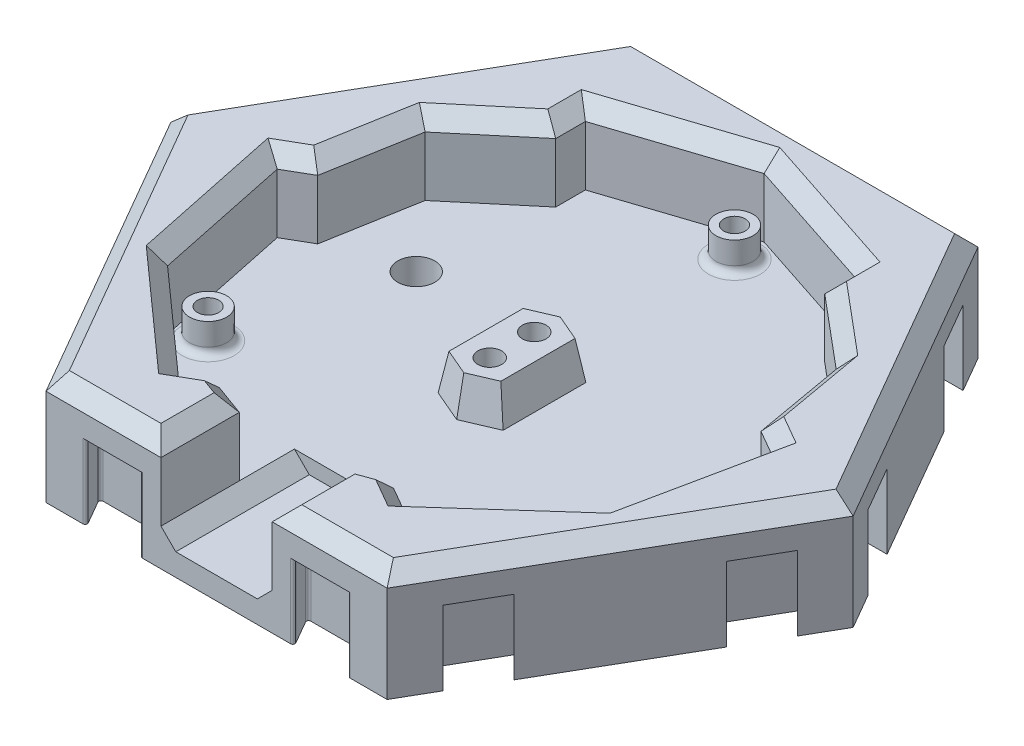
from build123d import *

# Parameters (mm, degrees)
BOSS_EXTRUDE1_DEPTH      = 15
CUT_EXTRUDE1_DEPTH       = 10
CIRPATTERN1_COUNT        = 3
CHAMFER1_SIZE            = 2
BOSS_EXTRUDE2_DEPTH      = 5
DRAFT1_ANGLE             = 10
SKETCH6_R                = 1.6
CUT_EXTRUDE2_DEPTH       = 106.872564907
SKETCH7_R                = 2.5
BOSS_EXTRUDE3_DEPTH      = 4
FILLET3_R                = 1
SKETCH11_R               = 1.44
CUT_EXTRUDE6_DEPTH       = 106.782796333
CIRPATTERN2_COUNT        = 3
FILLET3_OF_CIRPATTERN2_R = 1
SKETCH8_W                = 15
SKETCH8_H                = 12
CUT_EXTRUDE3_DEPTH       = 18
CHAMFER2_SIZE            = 2
CUT_EXTRUDE4_DEPTH       = 10
FILLET2_R                = 0.3
CIRPATTERN3_DEPTH        = 10
CUT_EXTRUDE7_DEPTH       = 7
SKETCH14_R               = 2.5
CUT_EXTRUDE8_DEPTH       = 107.46126056


# Read off the part's stored shape, not the designer's step: CirPattern3
with BuildPart() as part:
    # Sketch1 → Boss-Extrude1 (new body)
    with BuildSketch(Plane(origin=(0, 0, 0), x_dir=(1, 0, 0), z_dir=(0, 1, 0))):
        Polygon((0, 0), (46, 0), (69, 39.837168574), (46, 79.674337148), (0, 79.674337148), (-23, 39.837168574), align=None)
    extrude(amount=BOSS_EXTRUDE1_DEPTH)

    # Sketch4 → Cut-Extrude1 (cut)
    with BuildSketch(Plane(origin=(0, 15, 0), x_dir=(1, 0, 0), z_dir=(0, 1, 0))):
        Polygon((23, 7.837168574), (34.74615776, 12.112420366), (38.210259375, 10.112420366), (52.444863729, 22.837168574), (56.347516757, 41.527071661), (52.883415142, 43.527071661), (50.712812921, 55.837168574), (23, 39.837168574), align=None)
    cut_extrude1 = extrude(amount=-CUT_EXTRUDE1_DEPTH, mode=Mode.SUBTRACT)

    # CirPattern1: Cut-Extrude1 ×3 about axis
    cirpattern1_axis = Axis((23, 0, -39.837168574), (0, 1, 0))
    for i in range(1, CIRPATTERN1_COUNT):
        add(cut_extrude1.rotate(cirpattern1_axis, i * 360 / CIRPATTERN1_COUNT), mode=Mode.SUBTRACT)

    # Chamfer1
    chamfer1_edges = [part.edges().sort_by_distance(p)[0] for p in [
        (57.5, 15, -19.918584287),
        (57.5, 15, -59.755752861),
        (23, 15, -79.674337148),
        (-11.5, 15, -59.755752861),
        (28.87307888, 15, -9.97479447),
        (36.478208567, 15, -11.112420366),
        (45.327561552, 15, -16.47479447),
        (54.396190243, 15, -32.182120118),
        (54.61546595, 15, -42.527071661),
        (51.798114032, 15, -49.682120118),
        (-11.5, 15, -19.918584287),
        (45.925035152, 15, -59.854591135),
        (41.137257382, 15, -65.872013695),
        (32.068628691, 15, -70.854591135),
        (13.931371309, 15, -70.854591135),
        (4.862742618, 15, -65.872013695),
        (0.074964848, 15, -59.854591135),
        (-5.798114032, 15, -49.682120118),
        (-8.61546595, 15, -42.527071661),
        (-8.396190243, 15, -32.182120118),
        (0.672438448, 15, -16.47479447),
        (9.521791433, 15, -11.112420366),
        (17.12692112, 15, -9.97479447),
        (23, 15, 0),
    ]]
    chamfer(chamfer1_edges, length=CHAMFER1_SIZE)

    # Sketch5 → Boss-Extrude2 (add)
    with BuildSketch(Plane(origin=(0, 5, 0), x_dir=(1, 0, 0), z_dir=(0, 1, 0))):
        Polygon((26.5, 44.837168574), (26.5, 34.837168574), (23, 33.337168574), (19.5, 34.837168574), (19.5, 44.837168574), (23, 46.337168574), align=None)
    extrude(amount=BOSS_EXTRUDE2_DEPTH)

    # Draft1
    draft1_faces = [part.faces().sort_by_distance(p)[0] for p in [
        (19.5, 7.5, -39.837168574),
        (21.25, 7.5, -45.587168574),
        (24.75, 7.5, -45.587168574),
        (26.5, 7.5, -39.837168574),
        (21.25, 7.5, -34.087168574),
        (24.75, 7.5, -34.087168574),
    ]]
    draft(draft1_faces, Plane.ZX.offset(10), DRAFT1_ANGLE)

    # Sketch6 → Cut-Extrude2 (cut, through all)
    with BuildSketch(Plane(origin=(0, 10, 0), x_dir=(1, 0, 0), z_dir=(0, 1, 0))):
        with Locations(Location((23, 42.837168574, 0), (0, 0, 270))):
            Circle(SKETCH6_R)
        with Locations(Location((23, 36.837168574, 0), (0, 0, 270))):
            Circle(SKETCH6_R)
    extrude(amount=-CUT_EXTRUDE2_DEPTH, mode=Mode.SUBTRACT)

    # Sketch7 → Boss-Extrude3 (add)
    with BuildSketch(Plane(origin=(0, 5, 0), x_dir=(1, 0, 0), z_dir=(0, 1, 0))):
        with Locations(Location((48.980762114, 24.837168574, 0), (0, 0, 90))):
            Circle(SKETCH7_R)
    boss_extrude3 = extrude(amount=BOSS_EXTRUDE3_DEPTH)

    # Fillet3
    fillet3_edges = [part.edges().sort_by_distance(p)[0] for p in [
        (48.980762114, 5, -22.337168574),
    ]]
    fillet(fillet3_edges, radius=FILLET3_R)

    # Sketch11 → Cut-Extrude6 (cut, through all)
    with BuildSketch(Plane(origin=(0, 9, 0), x_dir=(1, 0, 0), z_dir=(0, 1, 0))):
        with Locations(Location((48.980762114, 24.837168574, 0), (0, 0, 270))):
            Circle(SKETCH11_R)
    cut_extrude6 = extrude(amount=-CUT_EXTRUDE6_DEPTH, mode=Mode.SUBTRACT)

    # CirPattern2: Boss-Extrude3, Cut-Extrude6 ×3 about axis
    cirpattern2_axis = Axis((23, 0, -39.837168574), (0, 1, 0))
    add([boss_extrude3.rotate(cirpattern2_axis, i * 360 / CIRPATTERN2_COUNT) for i in range(1, CIRPATTERN2_COUNT)])
    add([cut_extrude6.rotate(cirpattern2_axis, i * 360 / CIRPATTERN2_COUNT) for i in range(1, CIRPATTERN2_COUNT)], mode=Mode.SUBTRACT)

    # Fillet3 of CirPattern2
    fillet3_of_cirpattern2_edges = [part.edges().sort_by_distance(p)[0] for p in [
        (25.165063509, 5, -71.087168574),
        (-5.145825623, 5, -26.087168574),
    ]]
    fillet(fillet3_of_cirpattern2_edges, radius=FILLET3_OF_CIRPATTERN2_R)

    # Sketch8 → Cut-Extrude3 (cut)
    with BuildSketch(Plane.XY):
        with Locations((23, 9)):
            Rectangle(SKETCH8_W, SKETCH8_H)
    extrude(amount=-CUT_EXTRUDE3_DEPTH, mode=Mode.SUBTRACT)

    # Chamfer2
    chamfer2_edges = [part.edges().sort_by_distance(p)[0] for p in [
        (30.5, 15, -5.219294893),
        (30.5, 3, -9),
        (15.5, 3, -9),
        (15.5, 15, -5.219294893),
    ]]
    chamfer(chamfer2_edges, length=CHAMFER2_SIZE)

    # Sketch9 → Cut-Extrude4 (cut)
    with BuildSketch(Plane.XZ):
        Polygon((5.5, 0), (3.190598923, -4), (14.809401077, -4), (12.5, 0), align=None)
        Polygon((33.5, 0), (31.190598923, -4), (42.809401077, -4), (40.5, 0), align=None)
    extrude(amount=-CUT_EXTRUDE4_DEPTH, mode=Mode.SUBTRACT)

    # Fillet2
    fillet2_edges = [part.edges().sort_by_distance(p)[0] for p in [
        (5.5, 5, 0),
        (12.5, 5, 0),
        (14.809401077, 5, -4),
        (3.190598923, 5, -4),
        (33.5, 5, 0),
        (40.5, 5, 0),
        (42.809401077, 5, -4),
        (31.190598923, 5, -4),
    ]]
    fillet(fillet2_edges, radius=FILLET2_R)

    # CirPattern3 outline → CirPattern3 (cut)
    with BuildSketch(Plane(origin=(0, 0, 0), x_dir=(1, 0, 0), z_dir=(0, 1, 0))):
        with BuildLine():
            ThreePointArc((63.680791302, 41.050308295), (63.940598923, 40.900308295), (64.200406544, 41.050308295))
            Line((64.200406544, 41.050308295), (66.25, 44.600308295))
            Line((66.25, 44.600308295), (62.75, 50.662486121))
            Line((62.75, 50.662486121), (58.650813089, 50.662486121))
            ThreePointArc((58.650813089, 50.662486121), (58.391005468, 50.512486121), (58.391005468, 50.212486121))
            Line((58.391005468, 50.212486121), (63.680791302, 41.050308295))
        make_face()
        with BuildLine():
            Line((-4.200406544, 14.375317547), (-6.25, 10.825317547))
            Line((-6.25, 10.825317547), (-2.75, 4.763139721))
            Line((-2.75, 4.763139721), (1.349186911, 4.763139721))
            ThreePointArc((1.349186911, 4.763139721), (1.608994532, 4.913139721), (1.608994532, 5.213139721))
            Line((1.608994532, 5.213139721), (-3.680791302, 14.375317547))
            ThreePointArc((-3.680791302, 14.375317547), (-3.940598923, 14.525317547), (-4.200406544, 14.375317547))
        make_face()
        with BuildLine():
            Line((-18.200406544, 38.624028853), (-20.25, 35.074028853))
            Line((-20.25, 35.074028853), (-16.75, 29.011851027))
            Line((-16.75, 29.011851027), (-12.650813089, 29.011851027))
            ThreePointArc((-12.650813089, 29.011851027), (-12.391005468, 29.161851027), (-12.391005468, 29.461851027))
            Line((-12.391005468, 29.461851027), (-17.680791302, 38.624028853))
            ThreePointArc((-17.680791302, 38.624028853), (-17.940598923, 38.774028853), (-18.200406544, 38.624028853))
        make_face()
        with BuildLine():
            Line((-12.650813089, 50.662486121), (-16.75, 50.662486121))
            Line((-16.75, 50.662486121), (-20.25, 44.600308295))
            Line((-20.25, 44.600308295), (-18.200406544, 41.050308295))
            ThreePointArc((-18.200406544, 41.050308295), (-17.940598923, 40.900308295), (-17.680791302, 41.050308295))
            Line((-17.680791302, 41.050308295), (-12.391005468, 50.212486121))
            ThreePointArc((-12.391005468, 50.212486121), (-12.391005468, 50.512486121), (-12.650813089, 50.662486121))
        make_face()
        with BuildLine():
            Line((1.349186911, 74.911197427), (-2.75, 74.911197427))
            Line((-2.75, 74.911197427), (-6.25, 68.849019601))
            Line((-6.25, 68.849019601), (-4.200406544, 65.299019601))
            ThreePointArc((-4.200406544, 65.299019601), (-3.940598923, 65.149019601), (-3.680791302, 65.299019601))
            Line((-3.680791302, 65.299019601), (1.608994532, 74.461197427))
            ThreePointArc((1.608994532, 74.461197427), (1.608994532, 74.761197427), (1.349186911, 74.911197427))
        make_face()
        with BuildLine():
            Line((14.549593456, 76.124337148), (12.5, 79.674337148))
            Line((12.5, 79.674337148), (5.5, 79.674337148))
            Line((5.5, 79.674337148), (3.450406544, 76.124337148))
            ThreePointArc((3.450406544, 76.124337148), (3.450406544, 75.824337148), (3.710214166, 75.674337148))
            Line((3.710214166, 75.674337148), (14.289785834, 75.674337148))
            ThreePointArc((14.289785834, 75.674337148), (14.549593456, 75.824337148), (14.549593456, 76.124337148))
        make_face()
        with BuildLine():
            Line((42.549593456, 76.124337148), (40.5, 79.674337148))
            Line((40.5, 79.674337148), (33.5, 79.674337148))
            Line((33.5, 79.674337148), (31.450406544, 76.124337148))
            ThreePointArc((31.450406544, 76.124337148), (31.450406544, 75.824337148), (31.710214166, 75.674337148))
            Line((31.710214166, 75.674337148), (42.289785834, 75.674337148))
            ThreePointArc((42.289785834, 75.674337148), (42.549593456, 75.824337148), (42.549593456, 76.124337148))
        make_face()
        with BuildLine():
            Line((50.200406544, 65.299019601), (52.25, 68.849019601))
            Line((52.25, 68.849019601), (48.75, 74.911197427))
            Line((48.75, 74.911197427), (44.650813089, 74.911197427))
            ThreePointArc((44.650813089, 74.911197427), (44.391005468, 74.761197427), (44.391005468, 74.461197427))
            Line((44.391005468, 74.461197427), (49.680791302, 65.299019601))
            ThreePointArc((49.680791302, 65.299019601), (49.940598923, 65.149019601), (50.200406544, 65.299019601))
        make_face()
        with BuildLine():
            Line((48.75, 4.763139721), (52.25, 10.825317547))
            Line((52.25, 10.825317547), (50.200406544, 14.375317547))
            ThreePointArc((50.200406544, 14.375317547), (49.940598923, 14.525317547), (49.680791302, 14.375317547))
            Line((49.680791302, 14.375317547), (44.391005468, 5.213139721))
            ThreePointArc((44.391005468, 5.213139721), (44.391005468, 4.913139721), (44.650813089, 4.763139721))
            Line((44.650813089, 4.763139721), (48.75, 4.763139721))
        make_face()
        with BuildLine():
            Line((62.75, 29.011851027), (66.25, 35.074028853))
            Line((66.25, 35.074028853), (64.200406544, 38.624028853))
            ThreePointArc((64.200406544, 38.624028853), (63.940598923, 38.774028853), (63.680791302, 38.624028853))
            Line((63.680791302, 38.624028853), (58.391005468, 29.461851027))
            ThreePointArc((58.391005468, 29.461851027), (58.391005468, 29.161851027), (58.650813089, 29.011851027))
            Line((58.650813089, 29.011851027), (62.75, 29.011851027))
        make_face()
    extrude(amount=CIRPATTERN3_DEPTH, mode=Mode.SUBTRACT)

    # Sketch13 → Cut-Extrude7 (cut)
    with BuildSketch(Plane.XZ):
        with BuildLine():
            Line((19.75, -36.837168574), (19.75, -42.837168574))
            ThreePointArc((19.75, -42.837168574), (23, -46.087168574), (26.25, -42.837168574))
            Line((26.25, -42.837168574), (26.25, -36.837168574))
            ThreePointArc((26.25, -36.837168574), (23, -33.587168574), (19.75, -36.837168574))
        make_face()
    extrude(amount=-CUT_EXTRUDE7_DEPTH, mode=Mode.SUBTRACT)

    # Sketch14 → Cut-Extrude8 (cut, through all)
    with BuildSketch(Plane.XZ):
        with Locations(Location((2.99, -46.937168574, 0), (0, 0, 270))):
            Circle(SKETCH14_R)
    extrude(amount=-CUT_EXTRUDE8_DEPTH, mode=Mode.SUBTRACT)


solid = part.part
